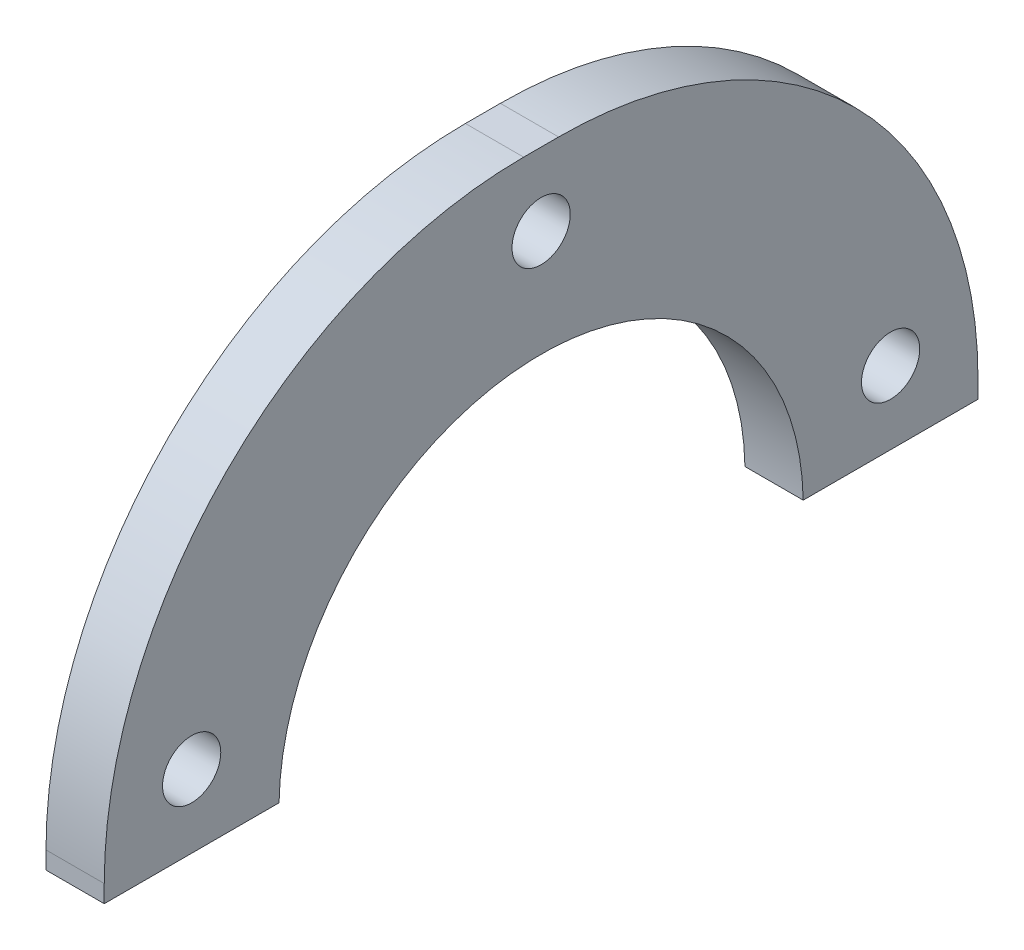
from build123d import *

# Parameters (mm, degrees)
SKETCH1_W                        = 47.625
SKETCH1_H                        = 23.8125
BOSS_EXTRUDE1_DEPTH              = 3.175
SKETCH2_R                        = 14.2875
CUT_EXTRUDE1_DEPTH               = 27.811836385
F_1_8_0_125_DIAMETER_HOLE1_D     = 3.175
F_1_8_0_125_DIAMETER_HOLE1_DEPTH = 19.001994
F_1_8_0_125_DIAMETER_HOLE1_TIP   = 0.953866233
FILLET1_R                        = 22.86


with BuildPart() as part:
    # Sketch1 → Boss-Extrude1 (new body)
    with BuildSketch(Plane(origin=(0, 0, 0), x_dir=(0, 0, -1), z_dir=(1, 0, 0))):
        Rectangle(SKETCH1_W, SKETCH1_H)
    extrude(amount=BOSS_EXTRUDE1_DEPTH)

    # Sketch2 → Cut-Extrude1 (cut, through all)
    with BuildSketch(Plane(origin=(3.175, 0, 0), x_dir=(0, 0, -1), z_dir=(1, 0, 0))):
        with Locations((0, -12.16025)):
            Circle(SKETCH2_R)
    extrude(amount=-CUT_EXTRUDE1_DEPTH, mode=Mode.SUBTRACT)

    # 1/8 (0.125) Diameter Hole1
    with Locations(Plane(origin=(3.175, 0, 0), x_dir=(0, 0, -1), z_dir=(1, 0, 0))):
        with Locations((-19.048871022, -7.9375), (0, 7.9375), (19.048871022, -7.9375)):
            Hole(F_1_8_0_125_DIAMETER_HOLE1_D / 2, depth=F_1_8_0_125_DIAMETER_HOLE1_DEPTH)
            with Locations((0, 0, -(F_1_8_0_125_DIAMETER_HOLE1_DEPTH + F_1_8_0_125_DIAMETER_HOLE1_TIP / 2))):  # 118° drill point
                Cone(0, F_1_8_0_125_DIAMETER_HOLE1_D / 2, F_1_8_0_125_DIAMETER_HOLE1_TIP, mode=Mode.SUBTRACT)

    # Fillet1
    fillet1_edges = [part.edges().sort_by_distance(p)[0] for p in [
        (1.5875, 11.90625, -23.8125),
        (1.5875, 11.90625, 23.8125),
    ]]
    fillet(fillet1_edges, radius=FILLET1_R)


solid = part.part
